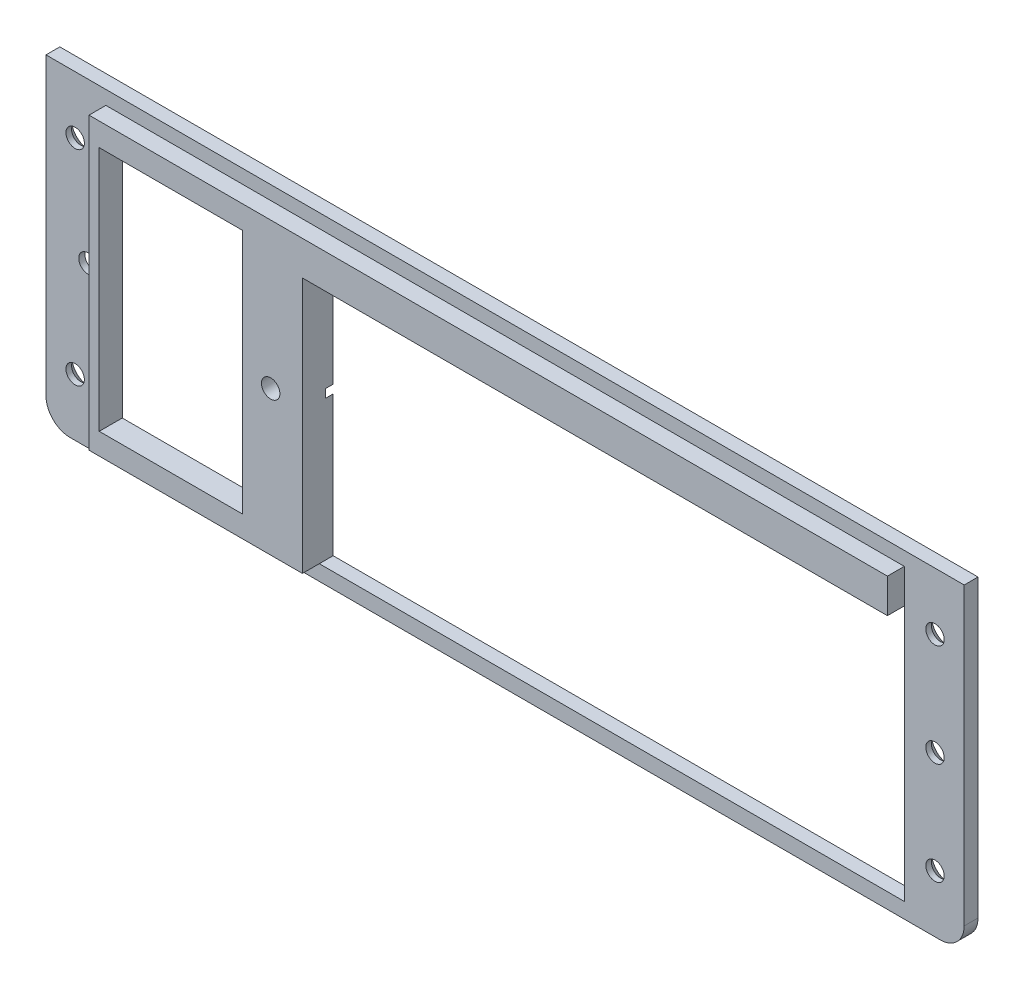
from build123d import *

# Parameters (mm, degrees)
SKETCH1_W                                       = 180
SKETCH1_H                                       = 63
BOSS_EXTRUDE1_DEPTH                             = 3
FILLET1_R                                       = 5
SKETCH2_W                                       = 156
SKETCH2_H                                       = 63
BOSS_EXTRUDE2_DEPTH                             = 6
CSK_FOR_M3_FLAT_HEAD_MACHINE_SCREW1_D           = 3.6
CSK_FOR_M3_FLAT_HEAD_MACHINE_SCREW1_DEPTH       = 8
CSK_FOR_M3_FLAT_HEAD_MACHINE_SCREW1_CSINK_D     = 6.8
CSK_FOR_M3_FLAT_HEAD_MACHINE_SCREW1_CSINK_ANGLE = 90
CSK_FOR_M3_FLAT_HEAD_MACHINE_SCREW1_TIP         = 1.081549114
CUT_EXTRUDE1_START                              = -1.5
CUT_EXTRUDE1_DEPTH                              = 1.5
SKETCH6_W                                       = 28
SKETCH6_H                                       = 48
CUT_EXTRUDE2_DEPTH                              = 96.647791402
FILLET2_R                                       = 2
M3_CLEARANCE_HOLE1_D                            = 3.6
M3_CLEARANCE_HOLE1_DEPTH                        = 8
M3_CLEARANCE_HOLE1_TIP                          = 1.081549114
SKETCH15_W                                      = 95
SKETCH15_H                                      = 63
CUT_EXTRUDE3_DEPTH                              = 3
SKETCH18_W                                      = 180
SKETCH18_H                                      = 8
CUT_EXTRUDE8_DEPTH                              = 3
SKETCH21_W                                      = 4
SKETCH21_H                                      = 60
CUT_EXTRUDE10_DEPTH                             = 3
SKETCH22_W                                      = 3
SKETCH22_H                                      = 60
CUT_EXTRUDE11_DEPTH                             = 116.733530146
CUT_EXTRUDE12_DEPTH                             = 0.3
CUT_EXTRUDE13_DEPTH                             = 96.541875636
SKETCH25_W                                      = 114
SKETCH25_H                                      = 50
CUT_EXTRUDE14_DEPTH                             = 96.160548548
SKETCH26_W                                      = 6
SKETCH26_H                                      = 50
CUT_EXTRUDE15_DEPTH                             = 0.3
SKETCH28_W                                      = 156
SKETCH28_H                                      = 3
CUT_EXTRUDE16_DEPTH                             = 3.3


# Read off the part's stored shape, not the designer's step: Cut-Extrude1
with BuildPart() as part:
    # Sketch1 → Boss-Extrude1 (new body)
    with BuildSketch(Plane.XY):
        Rectangle(SKETCH1_W, SKETCH1_H)
    extrude(amount=BOSS_EXTRUDE1_DEPTH)

    # Fillet1
    fillet1_edges = [part.edges().sort_by_distance(p)[0] for p in [
        (90, -31.5, 1.5),
        (-90, -31.5, 1.5),
    ]]
    fillet(fillet1_edges, radius=FILLET1_R)

    # Sketch2 → Boss-Extrude2 (add)
    with BuildSketch(Plane.XY.offset(3)):
        Rectangle(SKETCH2_W, SKETCH2_H)
    extrude(amount=BOSS_EXTRUDE2_DEPTH)

    # CSK for M3 Flat Head Machine Screw1
    with Locations(Plane(origin=(0, 0, 0), x_dir=(-1, 0, 0), z_dir=(0, 0, -1))):
        with Locations((-84, 20), (-84, -20), (84, 20), (84, -20), (-84, 0)):
            CounterSinkHole(CSK_FOR_M3_FLAT_HEAD_MACHINE_SCREW1_D / 2, CSK_FOR_M3_FLAT_HEAD_MACHINE_SCREW1_CSINK_D / 2, depth=CSK_FOR_M3_FLAT_HEAD_MACHINE_SCREW1_DEPTH, counter_sink_angle=CSK_FOR_M3_FLAT_HEAD_MACHINE_SCREW1_CSINK_ANGLE)
            with Locations((0, 0, -(CSK_FOR_M3_FLAT_HEAD_MACHINE_SCREW1_DEPTH + CSK_FOR_M3_FLAT_HEAD_MACHINE_SCREW1_TIP / 2))):  # 118° drill point
                Cone(0, CSK_FOR_M3_FLAT_HEAD_MACHINE_SCREW1_D / 2, CSK_FOR_M3_FLAT_HEAD_MACHINE_SCREW1_TIP, mode=Mode.SUBTRACT)

    # Cut-Extrude1 outline → Cut-Extrude1 (cut)
    with BuildSketch(Plane(origin=(0, 0, 0), x_dir=(-1, 0, 0), z_dir=(0, 0, -1)).offset(CUT_EXTRUDE1_START)):
        with BuildLine():
            Line((77, 30), (47, 30))
            Line((47, 30), (36, 0))
            Line((36, 0), (47, -30))
            Line((47, -30), (77, -30))
            Line((77, -30), (80.604262356, -20.170193575))
            ThreePointArc((80.604262356, -20.170193575), (80.807820526, -18.829534193), (81.519146067, -17.67505618))
            Line((81.519146067, -17.67505618), (88, 0))
            Line((88, 0), (81.519146067, 17.67505618))
            ThreePointArc((81.519146067, 17.67505618), (80.807820526, 18.829534193), (80.604262356, 20.170193575))
            Line((80.604262356, 20.170193575), (77, 30))
        make_face()
    extrude(amount=CUT_EXTRUDE1_DEPTH, mode=Mode.SUBTRACT)

    # Sketch6 → Cut-Extrude2 (cut, through all)
    with BuildSketch(Plane(origin=(0, 0, 1.5), x_dir=(-1, 0, 0), z_dir=(0, 0, -1))):
        with Locations((62, 0)):
            Rectangle(SKETCH6_W, SKETCH6_H)
    extrude(amount=-CUT_EXTRUDE2_DEPTH, mode=Mode.SUBTRACT)

    # Fillet2
    fillet2_edges = [part.edges().sort_by_distance(p)[0] for p in [
        (-36, 0, 0.75),
        (-47, 30, 0.75),
        (-77, 30, 0.75),
        (-88, 0, 0.75),
        (-77, -30, 0.75),
        (-47, -30, 0.75),
    ]]
    fillet(fillet2_edges, radius=FILLET2_R)

    # M3 Clearance Hole1
    with Locations(Plane(origin=(0, 0, 1.5), x_dir=(-1, 0, 0), z_dir=(0, 0, -1))):
        with Locations((42.5, 0), (81.5, 0)):
            Hole(M3_CLEARANCE_HOLE1_D / 2, depth=M3_CLEARANCE_HOLE1_DEPTH)
            with Locations((0, 0, -(M3_CLEARANCE_HOLE1_DEPTH + M3_CLEARANCE_HOLE1_TIP / 2))):  # 118° drill point
                Cone(0, M3_CLEARANCE_HOLE1_D / 2, M3_CLEARANCE_HOLE1_TIP, mode=Mode.SUBTRACT)

    # Sketch15 → Cut-Extrude3 (cut)
    with BuildSketch(Plane.XY.offset(9)):
        with Locations((26.5, 0)):
            Rectangle(SKETCH15_W, SKETCH15_H)
    extrude(amount=-CUT_EXTRUDE3_DEPTH, mode=Mode.SUBTRACT)

    # Sketch18 → Cut-Extrude8 (cut)
    with BuildSketch(Plane(origin=(0, 31.5, 0), x_dir=(1, 0, 0), z_dir=(0, 1, 0))):
        with Locations((0, -7)):
            Rectangle(SKETCH18_W, SKETCH18_H)
    extrude(amount=-CUT_EXTRUDE8_DEPTH, mode=Mode.SUBTRACT)

    # Sketch21 → Cut-Extrude10 (cut)
    with BuildSketch(Plane.XY.offset(9)):
        with Locations((76, -1.5)):
            Rectangle(SKETCH21_W, SKETCH21_H)
    extrude(amount=-CUT_EXTRUDE10_DEPTH, mode=Mode.SUBTRACT)

    # Sketch22 → Cut-Extrude11 (cut, through all)
    with BuildSketch(Plane(origin=(-21, 0, 0), x_dir=(0, 0, -1), z_dir=(1, 0, 0))):
        with Locations((-7.5, -1.5)):
            Rectangle(SKETCH22_W, SKETCH22_H)
    extrude(amount=-CUT_EXTRUDE11_DEPTH, mode=Mode.SUBTRACT)

    # Sketch23 → Cut-Extrude12 (cut)
    with BuildSketch(Plane.XY.offset(3)):
        with BuildLine():
            Line((90, 31.5), (-90, 31.5))
            Line((-90, 31.5), (-90, -26.5))
            ThreePointArc((-90, -26.5), (-88.535533906, -30.035533906), (-85, -31.5))
            Line((-85, -31.5), (-78, -31.5))
            Line((-78, -31.5), (-78, 28.5))
            Line((-78, 28.5), (78, 28.5))
            Line((78, 28.5), (78, -31.5))
            Line((78, -31.5), (85, -31.5))
            ThreePointArc((85, -31.5), (88.535533906, -30.035533906), (90, -26.5))
            Line((90, -26.5), (90, 31.5))
        make_face()
    extrude(amount=-CUT_EXTRUDE12_DEPTH, mode=Mode.SUBTRACT)

    # Sketch24 → Cut-Extrude13 (cut, through all)
    with BuildSketch(Plane(origin=(0, 0, 0), x_dir=(-1, 0, 0), z_dir=(0, 0, -1))):
        with BuildLine():
            Line((90, 31.5), (90, -26.5))
            ThreePointArc((90, -26.5), (88.535533906, -30.035533906), (85, -31.5))
            Line((85, -31.5), (-85, -31.5))
            ThreePointArc((-85, -31.5), (-88.535533906, -30.035533906), (-90, -26.5))
            Line((-90, -26.5), (-90, 31.5))
            Line((-90, 31.5), (90, 31.5))
        make_face()
        with BuildLine():
            Line((-85, -31.2), (85, -31.2))
            ThreePointArc((85, -31.2), (88.323401872, -29.823401872), (89.7, -26.5))
            Line((89.7, -26.5), (89.7, 31.2))
            Line((89.7, 31.2), (-89.7, 31.2))
            Line((-89.7, 31.2), (-89.7, -26.5))
            ThreePointArc((-89.7, -26.5), (-88.323401872, -29.823401872), (-85, -31.2))
        make_face(mode=Mode.SUBTRACT)
    extrude(amount=-CUT_EXTRUDE13_DEPTH, mode=Mode.SUBTRACT)

    # Sketch25 → Cut-Extrude14 (cut, through all)
    with BuildSketch(Plane(origin=(0, 0, 0), x_dir=(-1, 0, 0), z_dir=(0, 0, -1))):
        with Locations((-20.7, -3.2)):
            Rectangle(SKETCH25_W, SKETCH25_H)
    extrude(amount=-CUT_EXTRUDE14_DEPTH, mode=Mode.SUBTRACT)

    # Sketch26 → Cut-Extrude15 (cut)
    with BuildSketch(Plane.ZY.offset(-77.7)):
        with Locations((3, -3.2)):
            Rectangle(SKETCH26_W, SKETCH26_H)
    extrude(amount=-CUT_EXTRUDE15_DEPTH, mode=Mode.SUBTRACT)

    # Sketch28 → Cut-Extrude16 (cut)
    with BuildSketch(Plane.XY.offset(6)):
        with Locations((0, -29.7)):
            Rectangle(SKETCH28_W, SKETCH28_H)
    extrude(amount=-CUT_EXTRUDE16_DEPTH, mode=Mode.SUBTRACT)


solid = part.part
